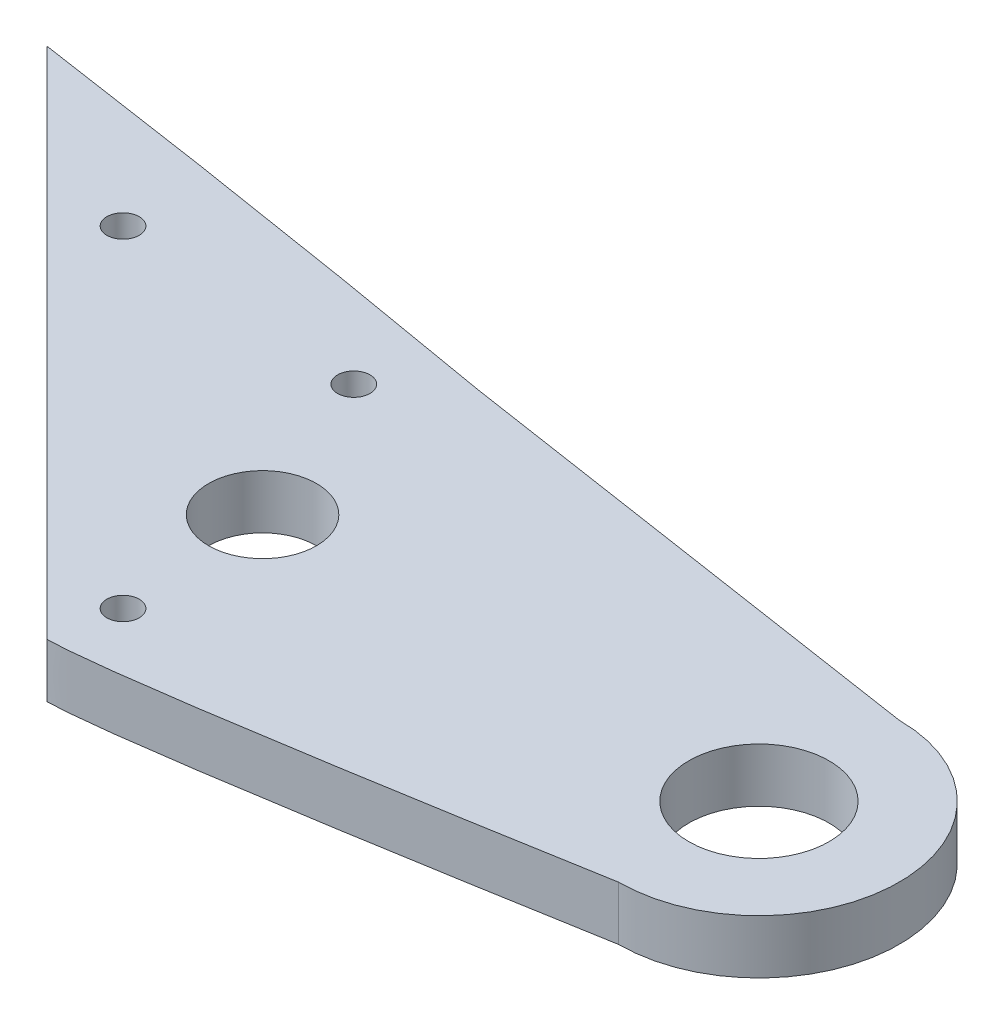
from build123d import *

# Parameters (mm, degrees)
BOSS_EXTRUDE1_DEPTH      = 20
BOSS_EXTRUDE1_DEPTH_BACK = 20
SKETCH1_R                = 5
SKETCH1_R_2              = 6.5
CUT_EXTRUDE2_DEPTH       = 343.928564136
CUT_EXTRUDE2_DEPTH_BACK  = 343.928564136
CUT_EXTRUDE3_DEPTH       = 50
CUT_EXTRUDE4_DEPTH       = 35
SKETCH6_R                = 1.5
CUT_EXTRUDE5_DEPTH       = 10


with BuildPart() as part:
    # Sketch1 → Boss-Extrude1 (new, two sides: drawn at the far end of the back side and taken through both)
    with BuildSketch(Plane(origin=(0, 0, 0), x_dir=(1, 0, 0), z_dir=(0, 1, 0)).offset(-BOSS_EXTRUDE1_DEPTH_BACK)):
        with BuildLine():
            ThreePointArc((-328.284271247, 28.284271247), (-328.284271247, -28.284271247), (-271.715728753, -28.284271247))
            add(Edge.make_bspline(
                [(-271.715728753, -28.284271247), (-189.219937614, 54.211519891), (-20, -20), (3.938998468, -20), (19.272331802, -17.666666667), (46, -13)],
                knots=[0, 0, 0, 0, 1, 1, 1.196949923, 1.196949923, 1.196949923, 1.196949923], degree=3))
            ThreePointArc((46, -13), (59, 0), (46, 13))
            add(Edge.make_bspline(
                [(46, 13), (0.03150303, 20), (0, 20)],
                knots=[0.358766717, 0.358766717, 0.358766717, 1.358766717, 1.358766717, 1.358766717], degree=2))
            add(Edge.make_bspline(
                [(0, 20), (-114.873131821, 40.378289836), (-300, 56.568542495), (-328.284271247, 28.284271247)],
                knots=[0.1900067, 0.1900067, 0.1900067, 0.1900067, 1.1900067, 1.1900067, 1.1900067, 1.1900067], degree=3))
        make_face()
        Circle(SKETCH1_R, mode=Mode.SUBTRACT)
        with Locations((46, 0)):
            Circle(SKETCH1_R_2, mode=Mode.SUBTRACT)
    extrude(amount=BOSS_EXTRUDE1_DEPTH + BOSS_EXTRUDE1_DEPTH_BACK)

    # Sketch3 → Cut-Extrude2 (cut, two sides: drawn at the far end of the back side and taken through both)
    with BuildSketch(Plane(origin=(-71.299423149, 0, -172.132034356), x_dir=(0.7071067811865464, 0, -0.7071067811865488), z_dir=(0.7071067811865488, 0, 0.7071067811865464)).offset(-CUT_EXTRUDE2_DEPTH_BACK)):
        with BuildLine():
            add(Edge.make_bspline(
                [(-283.431457505, -20), (-184.805428983, -3.480118101), (-115.265821393, -16.757568946), (-85.441558773, -20)],
                knots=[0, 0, 0, 0, 1, 1, 1, 1], degree=3))
            Line((-283.431457505, -20), (-85.441558773, -20))
        make_face()
        with BuildLine():
            Line((-85.441558773, 20), (-283.431457505, 20))
            add(Edge.make_bspline(
                [(-283.431457505, 20), (-184.805428983, 3.480118101), (-115.265821393, 16.757568946), (-85.441558773, 20)],
                knots=[0, 0, 0, 0, 1, 1, 1, 1], degree=3))
        make_face()
    extrude(amount=CUT_EXTRUDE2_DEPTH + CUT_EXTRUDE2_DEPTH_BACK, mode=Mode.SUBTRACT)

    # Sketch4 → Cut-Extrude3 (cut)
    with BuildSketch(Plane(origin=(0, 20, 0), x_dir=(1, 0, 0), z_dir=(0, 1, 0))):
        Polygon((-47.610226884, 27.610226884), (0, -20), (-373.544450592, -70.33009093), (-354.328395, 116.939105393), align=None)
    extrude(amount=-CUT_EXTRUDE3_DEPTH, mode=Mode.SUBTRACT)

    # Sketch5 → Cut-Extrude4 (cut)
    with BuildSketch(Plane(origin=(0, 20, 0), x_dir=(1, 0, 0), z_dir=(0, 1, 0))):
        Polygon((-57.275764697, 36.845269965), (76.245338427, 18.381653084), (61.085737199, -35.2600128), (-58.63624173, -33.316474181), align=None)
    extrude(amount=-CUT_EXTRUDE4_DEPTH, mode=Mode.SUBTRACT)

    # Sketch6 → Cut-Extrude5 (cut)
    with BuildSketch(Plane(origin=(0, -20, 0), x_dir=(-1, 0, 0), z_dir=(0, -1, 0))):
        with Locations((-1.069927016, -13.998859204)):
            Circle(SKETCH6_R)
        with Locations((6.243183599, 14.697159854)):
            Circle(SKETCH6_R)
        with Locations((29.628009639, 16.699077451)):
            Circle(SKETCH6_R)
    extrude(amount=-CUT_EXTRUDE5_DEPTH, mode=Mode.SUBTRACT)


solid = part.part
